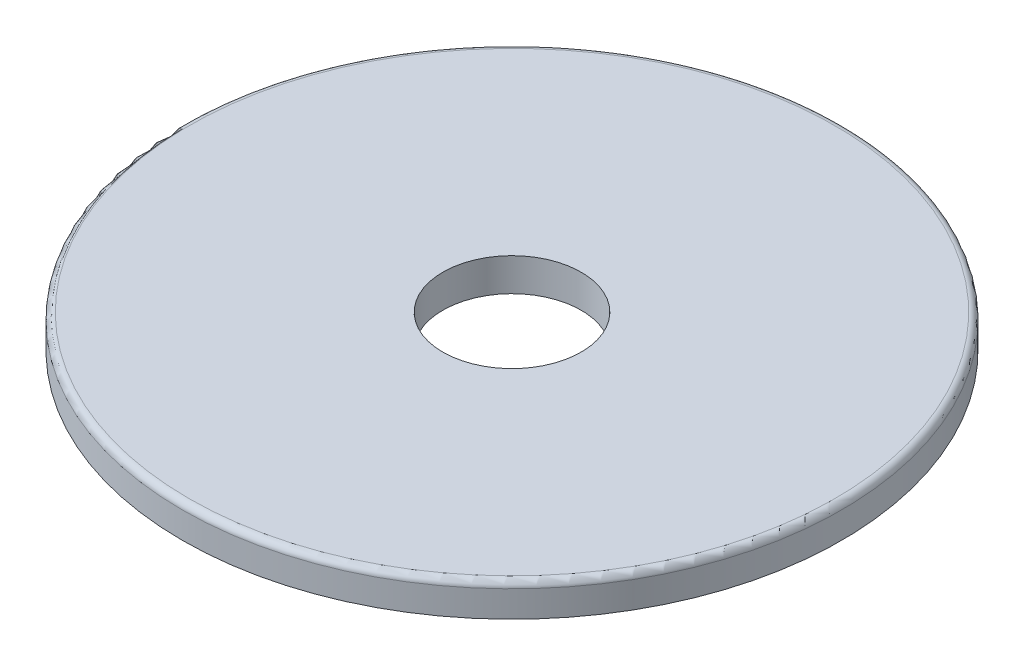
from build123d import *

# Parameters (mm, degrees)
SKETCH_1_R      = 10
SKETCH_1_R_2    = 2.1
EXTRUDE_1_DEPTH = 1
FILLET_1_R      = 0.2


with BuildPart() as part:
    # 草图1 → 凸台-拉伸1 (new body)
    with BuildSketch(Plane(origin=(0, 0, 0), x_dir=(1, 0, 0), z_dir=(0, 1, 0))):
        Circle(SKETCH_1_R)
        Circle(SKETCH_1_R_2, mode=Mode.SUBTRACT)
    extrude(amount=EXTRUDE_1_DEPTH)

    # 圆角1
    fillet_1_edges = [part.edges().sort_by_distance(p)[0] for p in [
        (-10, 1, 0),
    ]]
    fillet(fillet_1_edges, radius=FILLET_1_R)


solid = part.part
